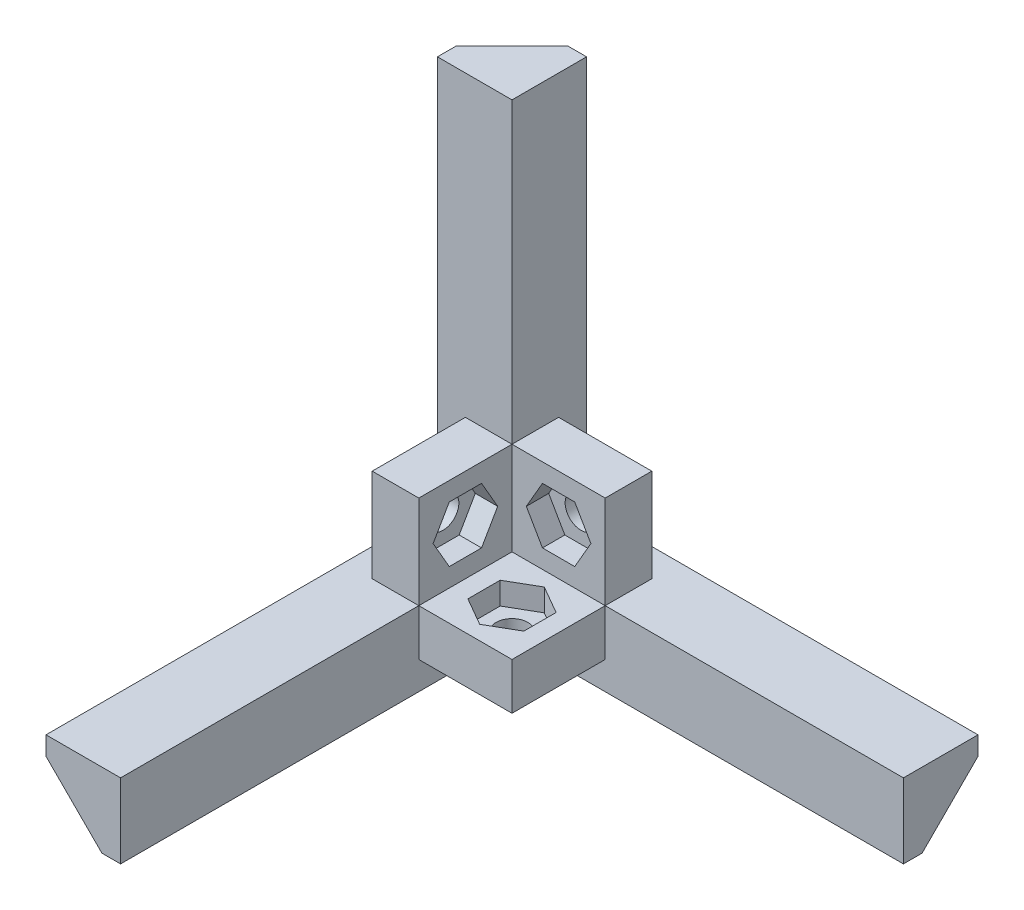
from build123d import *

# Parameters (mm, degrees)
BOSS_EXTRUDE1_DEPTH     = 8
SKETCH2_W               = 8
SKETCH2_H               = 8
BOSS_EXTRUDE2_DEPTH     = 42
SKETCH3_W               = 10
SKETCH3_H               = 5
BOSS_EXTRUDE3_DEPTH     = 10
CUT_EXTRUDE1_REACH      = 82.455
SKETCH4_R               = 1.7
CUT_EXTRUDE2_DEPTH      = 2.4
CHAMFER1_SIZE           = 6
MIRROR2_COPY_1_SKETCH_W = 10
MIRROR2_COPY_1_SKETCH_H = 5
MIRROR2_COPY_1_DEPTH    = 10
MIRROR2_COPY_2_REACH    = 82.455
MIRROR2_COPY_2_SKETCH_R = 1.7
MIRROR2_COPY_3_DEPTH    = 2.4
MIRROR2_COPY_4_SKETCH_W = 10
MIRROR2_COPY_4_SKETCH_H = 5
MIRROR2_COPY_4_DEPTH    = 10
MIRROR2_COPY_5_REACH    = 82.455
MIRROR2_COPY_5_SKETCH_R = 1.7
MIRROR2_COPY_6_DEPTH    = 2.4


with BuildPart() as part:
    # Sketch1 → Boss-Extrude1 (new body)
    with BuildSketch(Plane.XY):
        Polygon((0, 0), (0, 42), (-8, 42), (-8, -8), (42, -8), (42, 0), align=None)
    extrude(amount=BOSS_EXTRUDE1_DEPTH)

    # Sketch2 → Boss-Extrude2 (add)
    with BuildSketch(Plane.XY.offset(8)):
        with Locations((-4, -4)):
            Rectangle(SKETCH2_W, SKETCH2_H)
    extrude(amount=BOSS_EXTRUDE2_DEPTH)

    # Sketch3 → Boss-Extrude3 (add)
    with BuildSketch(Plane.XY.offset(8)):
        with Locations((5, -2.5)):
            Rectangle(SKETCH3_W, SKETCH3_H)
    boss_extrude3 = extrude(amount=BOSS_EXTRUDE3_DEPTH)

    # Sketch4 → Cut-Extrude1 (cut, up to next)
    with BuildSketch(Plane.XZ.offset(5), mode=Mode.PRIVATE) as cut_extrude1_sk1:
        with Locations((5, 13)):
            Circle(SKETCH4_R)
    cut_extrude1_tool1 = extrude(cut_extrude1_sk1.sketch, amount=-CUT_EXTRUDE1_REACH, mode=Mode.PRIVATE) & part.part
    cut_extrude1 = cut_extrude1_tool1.solids().sort_by_distance((5, -5, 13))[0]
    add(cut_extrude1, mode=Mode.SUBTRACT)

    # Sketch5 → Cut-Extrude2 (cut)
    with BuildSketch(Plane(origin=(0, 0, 0), x_dir=(1, 0, 0), z_dir=(0, 1, 0))):
        Polygon((8.464101615, -13), (6.732050808, -10), (3.267949192, -10), (1.535898385, -13), (3.267949192, -16), (6.732050808, -16), align=None)
    cut_extrude2 = extrude(amount=-CUT_EXTRUDE2_DEPTH, mode=Mode.SUBTRACT)

    # Mirror1: Boss-Extrude3, Cut-Extrude1, Cut-Extrude2 across plane
    add(boss_extrude3.mirror(Plane(origin=(0, -4, 4), x_dir=(0, 0.7071067811865489, 0.7071067811865462), z_dir=(0, 0.7071067811865464, -0.7071067811865488))))
    add(cut_extrude1.mirror(Plane(origin=(0, -4, 4), x_dir=(0, 0.7071067811865489, 0.7071067811865462), z_dir=(0, 0.7071067811865464, -0.7071067811865488))), mode=Mode.SUBTRACT)
    add(cut_extrude2.mirror(Plane(origin=(0, -4, 4), x_dir=(0, 0.7071067811865489, 0.7071067811865462), z_dir=(0, 0.7071067811865464, -0.7071067811865488))), mode=Mode.SUBTRACT)

    # Chamfer1
    chamfer1_edges = [part.edges().sort_by_distance(p)[0] for p in [
        (-8, 17, 0),
        (-8, -8, 25),
        (17, -8, 0),
    ]]
    chamfer(chamfer1_edges, length=CHAMFER1_SIZE)

    # Mirror2 copy 1 sketch → Mirror2 copy 1 (add)
    with BuildSketch(Plane(origin=(0, 0, 8), x_dir=(0, 0, 1), z_dir=(0, 1, 0))):
        with Locations((5, -2.5)):
            Rectangle(MIRROR2_COPY_1_SKETCH_W, MIRROR2_COPY_1_SKETCH_H)
    extrude(amount=MIRROR2_COPY_1_DEPTH)

    # Mirror2 copy 2 sketch → Mirror2 copy 2 (cut, up to next)
    with BuildSketch(Plane(origin=(-5, -8, 8), x_dir=(0, 0, 1), z_dir=(-1, 0, 0)), mode=Mode.PRIVATE) as mirror2_copy_2_sk1:
        with Locations((5, 13)):
            Circle(MIRROR2_COPY_2_SKETCH_R)
    mirror2_copy_2_tool1 = extrude(mirror2_copy_2_sk1.sketch, amount=-MIRROR2_COPY_2_REACH, mode=Mode.PRIVATE) & part.part
    add(mirror2_copy_2_tool1.solids().sort_by_distance((-5, 5, 13))[0], mode=Mode.SUBTRACT)

    # Mirror2 copy 3 sketch → Mirror2 copy 3 (cut)
    with BuildSketch(Plane(origin=(0, -8, 8), x_dir=(0, 0, 1), z_dir=(1, 0, 0))):
        Polygon((8.464101615, -13), (6.732050808, -10), (3.267949192, -10), (1.535898385, -13), (3.267949192, -16), (6.732050808, -16), align=None)
    extrude(amount=-MIRROR2_COPY_3_DEPTH, mode=Mode.SUBTRACT)

    # Mirror2 copy 4 sketch → Mirror2 copy 4 (add)
    with BuildSketch(Plane(origin=(0, 0, 8), x_dir=(0, 0, 1), z_dir=(1, 0, 0))):
        with Locations((5, 2.5)):
            Rectangle(MIRROR2_COPY_4_SKETCH_W, MIRROR2_COPY_4_SKETCH_H)
    extrude(amount=MIRROR2_COPY_4_DEPTH)

    # Mirror2 copy 5 sketch → Mirror2 copy 5 (cut, up to next)
    with BuildSketch(Plane(origin=(-8, -5, 8), x_dir=(0, 0, 1), z_dir=(0, -1, 0)), mode=Mode.PRIVATE) as mirror2_copy_5_sk1:
        with Locations((5, -13)):
            Circle(MIRROR2_COPY_5_SKETCH_R)
    mirror2_copy_5_tool1 = extrude(mirror2_copy_5_sk1.sketch, amount=-MIRROR2_COPY_5_REACH, mode=Mode.PRIVATE) & part.part
    add(mirror2_copy_5_tool1.solids().sort_by_distance((5, -5, 13))[0], mode=Mode.SUBTRACT)

    # Mirror2 copy 6 sketch → Mirror2 copy 6 (cut)
    with BuildSketch(Plane(origin=(-8, 0, 8), x_dir=(0, 0, 1), z_dir=(0, 1, 0))):
        Polygon((8.464101615, 13), (6.732050808, 10), (3.267949192, 10), (1.535898385, 13), (3.267949192, 16), (6.732050808, 16), align=None)
    extrude(amount=-MIRROR2_COPY_6_DEPTH, mode=Mode.SUBTRACT)


solid = part.part
